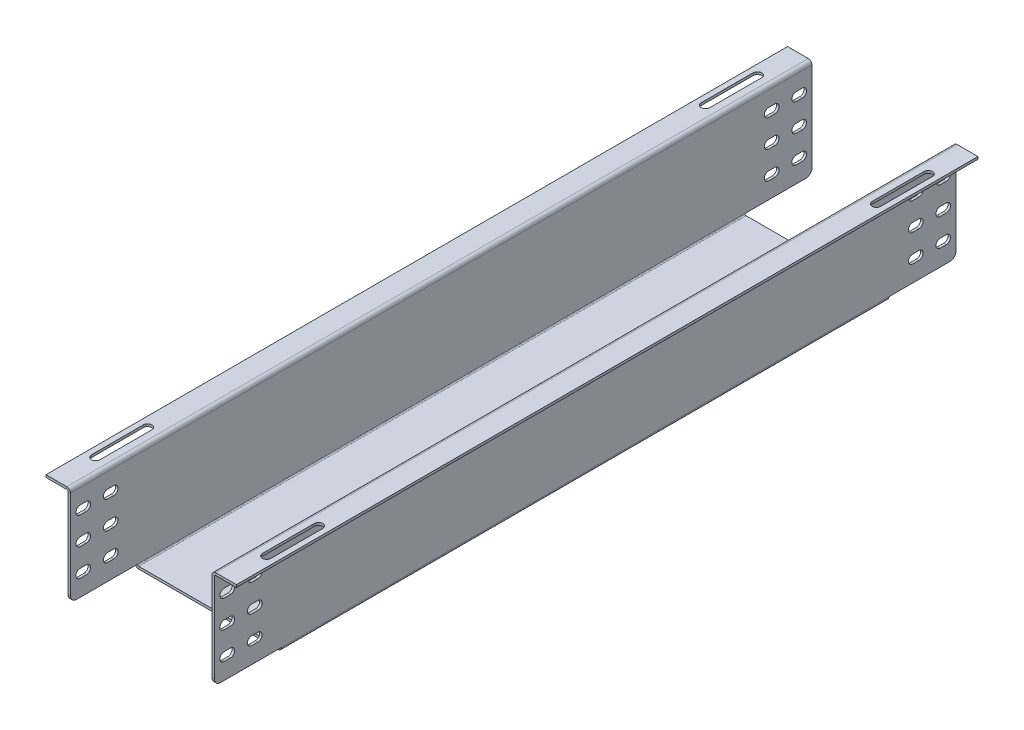
from build123d import *

# Parameters (mm, degrees)
BASE_FLANGE1_DEPTH = 1215
SKETCH6_W          = 110
SKETCH6_H          = 6
CUT_EXTRUDE1_DEPTH = 1257.7008395
CUT_EXTRUDE2_DEPTH = 1257.7008395
SKETCH8_R          = 6
CUT_EXTRUDE3_DEPTH = 1257.357035241
FILLET1_R          = 10


# Sheet-metal steps are written as plain solids
with BuildPart() as part:
    # Sketch1 → Base-Flange1 (new body)
    with BuildSketch(Plane.XY):
        with BuildLine():
            Line((-40, 164), (-6, 164))
            ThreePointArc((-6, 164), (-1.757359313, 162.242640687), (0, 158))
            Line((0, 158), (0, 2))
            ThreePointArc((0, 2), (0.585786438, 0.585786438), (2, 0))
            Line((2, 0), (230, 0))
            ThreePointArc((230, 0), (231.414213562, 0.585786438), (232, 2))
            Line((232, 2), (232, 158))
            ThreePointArc((232, 158), (233.757359313, 162.242640687), (238, 164))
            Line((238, 164), (272, 164))
            Line((272, 164), (272, 160))
            Line((272, 160), (238, 160))
            ThreePointArc((238, 160), (236.585786438, 159.414213562), (236, 158))
            Line((236, 158), (236, 2))
            ThreePointArc((236, 2), (234.242640687, -2.242640687), (230, -4))
            Line((230, -4), (2, -4))
            ThreePointArc((2, -4), (-2.242640687, -2.242640687), (-4, 2))
            Line((-4, 2), (-4, 158))
            ThreePointArc((-4, 158), (-4.585786438, 159.414213562), (-6, 160))
            Line((-6, 160), (-40, 160))
            Line((-40, 160), (-40, 164))
        make_face()
    extrude(amount=BASE_FLANGE1_DEPTH)

    # Sketch6 → Cut-Extrude1 (cut, through all)
    with BuildSketch(Plane(origin=(-4, 0, 0), x_dir=(0, 0, -1), z_dir=(1, 0, 0))):
        with Locations((-55, -1)):
            Rectangle(SKETCH6_W, SKETCH6_H)
        with Locations((-1160, -1)):
            Rectangle(SKETCH6_W, SKETCH6_H)
    extrude(amount=CUT_EXTRUDE1_DEPTH, mode=Mode.SUBTRACT)

    # Sketch7 → Cut-Extrude2 (cut, through all)
    with BuildSketch(Plane.ZY.offset(4)):
        with BuildLine():
            Line((26, 119), (16, 119))
            ThreePointArc((16, 119), (9, 126), (16, 133))
            Line((16, 133), (26, 133))
            ThreePointArc((26, 133), (33, 126), (26, 119))
        make_face()
        with BuildLine():
            Line((71, 119), (61, 119))
            ThreePointArc((61, 119), (54, 126), (61, 133))
            Line((61, 133), (71, 133))
            ThreePointArc((71, 133), (78, 126), (71, 119))
        make_face()
        with BuildLine():
            Line((71, 74), (61, 74))
            ThreePointArc((61, 74), (54, 81), (61, 88))
            Line((61, 88), (71, 88))
            ThreePointArc((71, 88), (78, 81), (71, 74))
        make_face()
        with BuildLine():
            Line((71, 29), (61, 29))
            ThreePointArc((61, 29), (54, 36), (61, 43))
            Line((61, 43), (71, 43))
            ThreePointArc((71, 43), (78, 36), (71, 29))
        make_face()
        with BuildLine():
            Line((26, 74), (16, 74))
            ThreePointArc((16, 74), (9, 81), (16, 88))
            Line((16, 88), (26, 88))
            ThreePointArc((26, 88), (33, 81), (26, 74))
        make_face()
        with BuildLine():
            Line((26, 29), (16, 29))
            ThreePointArc((16, 29), (9, 36), (16, 43))
            Line((16, 43), (26, 43))
            ThreePointArc((26, 43), (33, 36), (26, 29))
        make_face()
        with BuildLine():
            Line((1189, 119), (1199, 119))
            ThreePointArc((1199, 119), (1206, 126), (1199, 133))
            Line((1199, 133), (1189, 133))
            ThreePointArc((1189, 133), (1182, 126), (1189, 119))
        make_face()
        with BuildLine():
            Line((1144, 119), (1154, 119))
            ThreePointArc((1154, 119), (1161, 126), (1154, 133))
            Line((1154, 133), (1144, 133))
            ThreePointArc((1144, 133), (1137, 126), (1144, 119))
        make_face()
        with BuildLine():
            Line((1144, 74), (1154, 74))
            ThreePointArc((1154, 74), (1161, 81), (1154, 88))
            Line((1154, 88), (1144, 88))
            ThreePointArc((1144, 88), (1137, 81), (1144, 74))
        make_face()
        with BuildLine():
            Line((1144, 29), (1154, 29))
            ThreePointArc((1154, 29), (1161, 36), (1154, 43))
            Line((1154, 43), (1144, 43))
            ThreePointArc((1144, 43), (1137, 36), (1144, 29))
        make_face()
        with BuildLine():
            Line((1189, 74), (1199, 74))
            ThreePointArc((1199, 74), (1206, 81), (1199, 88))
            Line((1199, 88), (1189, 88))
            ThreePointArc((1189, 88), (1182, 81), (1189, 74))
        make_face()
        with BuildLine():
            Line((1189, 29), (1199, 29))
            ThreePointArc((1199, 29), (1206, 36), (1199, 43))
            Line((1199, 43), (1189, 43))
            ThreePointArc((1189, 43), (1182, 36), (1189, 29))
        make_face()
    extrude(amount=-CUT_EXTRUDE2_DEPTH, mode=Mode.SUBTRACT)

    # Sketch8 → Cut-Extrude3 (cut, through all)
    with BuildSketch(Plane(origin=(0, 164, 0), x_dir=(1, 0, 0), z_dir=(0, 1, 0))):
        with Locations(Location((116, -607.5, 0), (0, 0, 270))):
            Circle(SKETCH8_R)
        with BuildLine():
            Line((249, -1149.5), (249, -1064.5))
            ThreePointArc((249, -1064.5), (256, -1057.5), (263, -1064.5))
            Line((263, -1064.5), (263, -1149.5))
            ThreePointArc((263, -1149.5), (256, -1156.5), (249, -1149.5))
        make_face()
        with BuildLine():
            Line((249, -65.5), (249, -150.5))
            ThreePointArc((249, -150.5), (256, -157.5), (263, -150.5))
            Line((263, -150.5), (263, -65.5))
            ThreePointArc((263, -65.5), (256, -58.5), (249, -65.5))
        make_face()
        with BuildLine():
            Line((-17, -65.5), (-17, -150.5))
            ThreePointArc((-17, -150.5), (-24, -157.5), (-31, -150.5))
            Line((-31, -150.5), (-31, -65.5))
            ThreePointArc((-31, -65.5), (-24, -58.5), (-17, -65.5))
        make_face()
        with BuildLine():
            Line((-17, -1149.5), (-17, -1064.5))
            ThreePointArc((-17, -1064.5), (-24, -1057.5), (-31, -1064.5))
            Line((-31, -1064.5), (-31, -1149.5))
            ThreePointArc((-31, -1149.5), (-24, -1156.5), (-17, -1149.5))
        make_face()
    extrude(amount=-CUT_EXTRUDE3_DEPTH, mode=Mode.SUBTRACT)

    # Fillet1
    fillet1_edges = [part.edges().sort_by_distance(p)[0] for p in [
        (234, 2, 0),
        (234, 2, 1215),
        (-2, 2, 0),
        (-2, 2, 1215),
    ]]
    fillet(fillet1_edges, radius=FILLET1_R)


solid = part.part
